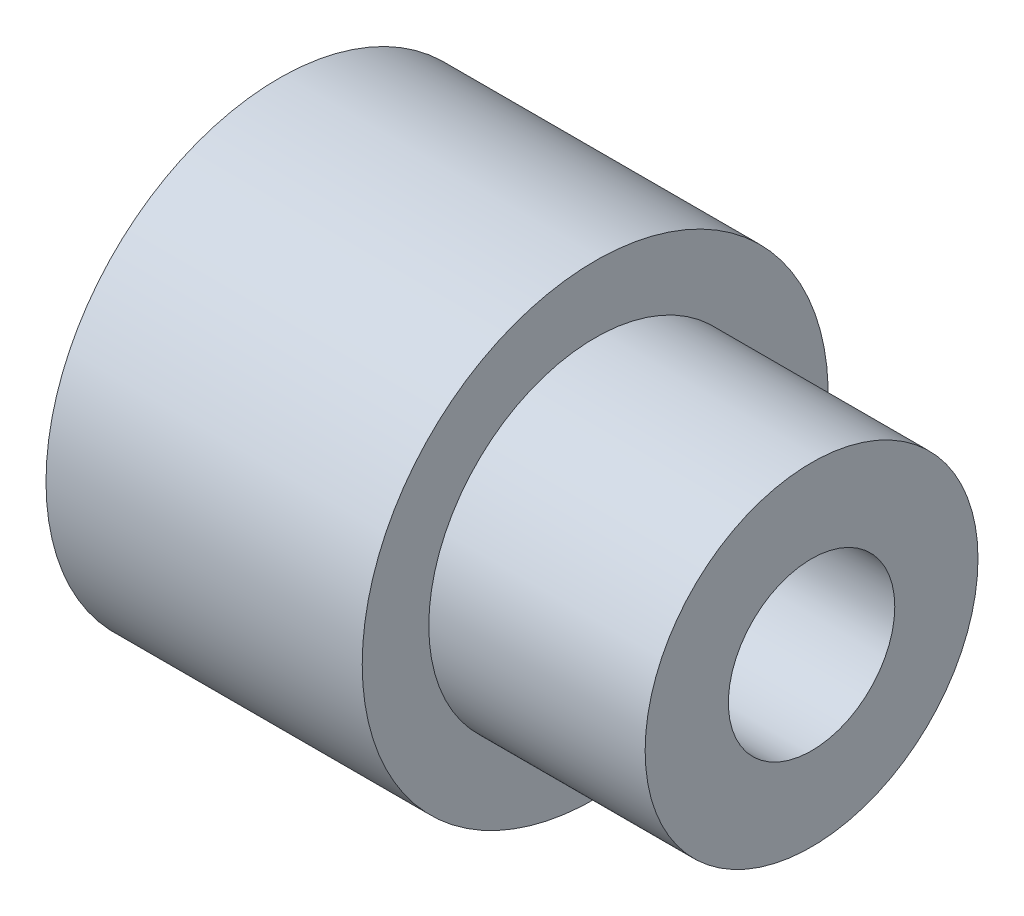
from build123d import *

# Parameters (mm, degrees)
SKETCH1_R           = 10
BOSS_EXTRUDE1_DEPTH = 13
SKETCH2_R           = 14
BOSS_EXTRUDE2_DEPTH = 19
SKETCH3_R           = 11
CUT_EXTRUDE1_DEPTH  = 6
SKETCH4_R           = 9
CUT_EXTRUDE2_DEPTH  = 10
SKETCH5_R           = 5
CUT_EXTRUDE3_DEPTH  = 38.629775444
FILLET1_R           = 0.05


with BuildPart() as part:
    # Sketch1 → Boss-Extrude1 (new body)
    with BuildSketch(Plane(origin=(0, 0, 0), x_dir=(0, 0, -1), z_dir=(1, 0, 0))):
        Circle(SKETCH1_R)
    extrude(amount=BOSS_EXTRUDE1_DEPTH)

    # Sketch2 → Boss-Extrude2 (add)
    with BuildSketch(Plane.ZY):
        Circle(SKETCH2_R)
    extrude(amount=BOSS_EXTRUDE2_DEPTH)

    # Sketch3 → Cut-Extrude1 (cut)
    with BuildSketch(Plane.ZY.offset(19)):
        Circle(SKETCH3_R)
    extrude(amount=-CUT_EXTRUDE1_DEPTH, mode=Mode.SUBTRACT)

    # Sketch4 → Cut-Extrude2 (cut)
    with BuildSketch(Plane.ZY.offset(13)):
        Circle(SKETCH4_R)
    extrude(amount=-CUT_EXTRUDE2_DEPTH, mode=Mode.SUBTRACT)

    # Sketch5 → Cut-Extrude3 (cut, through all)
    with BuildSketch(Plane(origin=(13, 0, 0), x_dir=(0, 0, -1), z_dir=(1, 0, 0))):
        Circle(SKETCH5_R)
    extrude(amount=-CUT_EXTRUDE3_DEPTH, mode=Mode.SUBTRACT)

    # Fillet1
    fillet1_edges = [part.edges().sort_by_distance(p)[0] for p in [
        (-19, 0, -11),
    ]]
    fillet(fillet1_edges, radius=FILLET1_R)


solid = part.part
